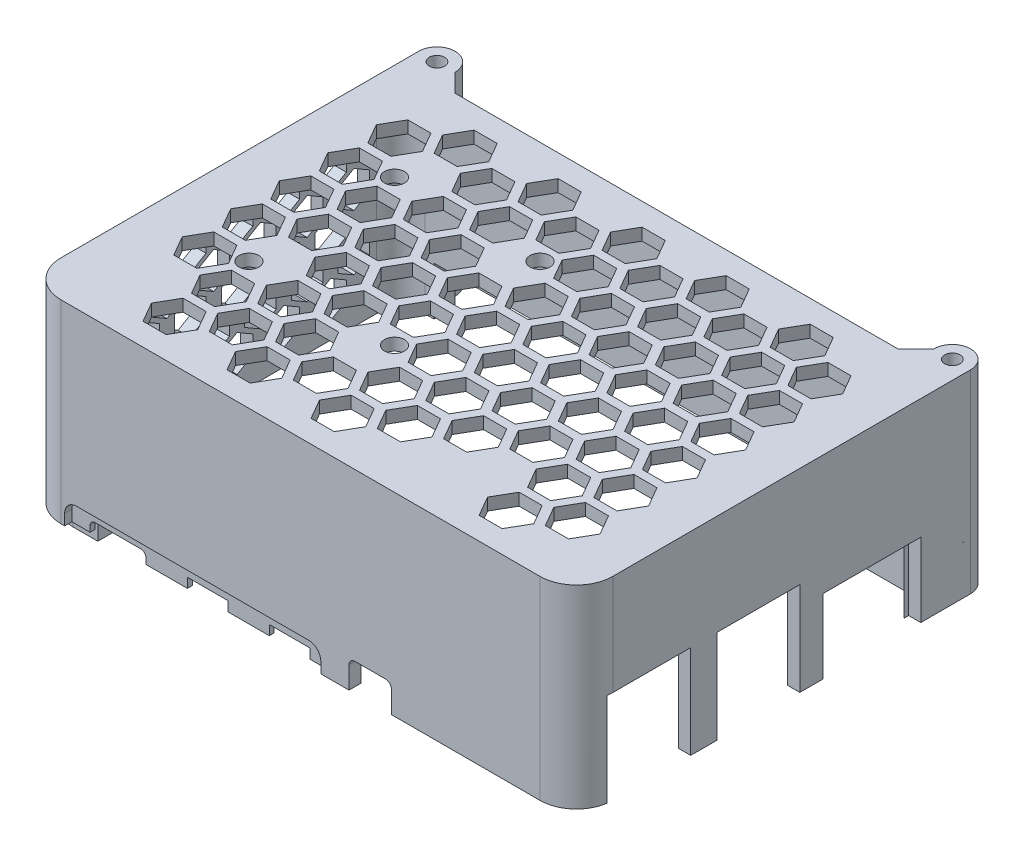
from build123d import *

# Parameters (mm, degrees)
BOSS_EXTRUDE1_DEPTH = 2
BOSS_EXTRUDE2_START = -30
BOSS_EXTRUDE2_DEPTH = 30
BOSS_EXTRUDE3_START = 32
SKETCH12_R          = 1.275
BOSS_EXTRUDE3_DEPTH = 32
BOSS_EXTRUDE4_START = -31.45
SKETCH3_R           = 1.275
BOSS_EXTRUDE4_DEPTH = 31.45
SKETCH5_W           = 2
SKETCH5_H           = 16.1
SKETCH5_H_2         = 13.7
SKETCH5_W_2         = 9.2
SKETCH5_H_3         = 2
SKETCH5_W_3         = 6.7
SKETCH5_W_4         = 7
CUT_EXTRUDE2_DEPTH  = 1.6
CUT_EXTRUDE3_DEPTH  = 0.2
FILLET1_R           = 0.8
SKETCH14_W          = 7
SKETCH14_H          = 2
CUT_EXTRUDE4_DEPTH  = 3
SKETCH15_W          = 2
SKETCH15_H          = 13.7
CUT_EXTRUDE5_DEPTH  = 13.8
CUT_EXTRUDE6_DEPTH  = 10.6
CHAMFER1_SIZE       = 3
CUT_EXTRUDE7_REACH  = 113.055
SKETCH18_W          = 55.5
SKETCH18_H          = 8
FILLET2_R           = 1
CUT_EXTRUDE8_DEPTH  = 1.2
SKETCH23_R          = 1.65
CUT_EXTRUDE11_DEPTH = 115.402371042
FILL_PATTERN1_DEPTH = 2
FILL_START          = -3
FILL_PATTERN5_DEPTH = 2


# Read off the part's stored shape, not the designer's step: Fill Pattern1, Fill Pattern5
# Some blends are built 0.0001 mm under size
with BuildPart() as part:
    # Sketch1 → Boss-Extrude1 (new body)
    with BuildSketch(Plane(origin=(0, 0, 0), x_dir=(1, 0, 0), z_dir=(0, 1, 0))):
        with BuildLine():
            Line((-3, 3), (-3, 53))
            ThreePointArc((-3, 53), (-1.242640687, 57.242640687), (3, 59))
            Line((3, 59), (82, 59))
            ThreePointArc((82, 59), (86.242640687, 57.242640687), (88, 53))
            Line((88, 53), (88, 3))
            ThreePointArc((88, 3), (86.242640687, -1.242640687), (82, -3))
            Line((82, -3), (3, -3))
            ThreePointArc((3, -3), (-1.242640687, -1.242640687), (-3, 3))
        make_face()
    extrude(amount=BOSS_EXTRUDE1_DEPTH)

    # Sketch2 → Boss-Extrude2 (add)
    with BuildSketch(Plane(origin=(0, 0, 0), x_dir=(1, 0, 0), z_dir=(0, 1, 0)).offset(BOSS_EXTRUDE2_START)):
        with BuildLine():
            Line((3, -3), (82, -3))
            ThreePointArc((82, -3), (86.242640687, -1.242640687), (88, 3))
            Line((88, 3), (88, 53))
            ThreePointArc((88, 53), (86.242640687, 57.242640687), (82, 59))
            Line((82, 59), (3, 59))
            ThreePointArc((3, 59), (-1.242640687, 57.242640687), (-3, 53))
            Line((-3, 53), (-3, 3))
            ThreePointArc((-3, 3), (-1.242640687, -1.242640687), (3, -3))
        make_face()
        with BuildLine():
            Line((82, 57), (3, 57))
            ThreePointArc((3, 57), (0.171572875, 55.828427125), (-1, 53))
            Line((-1, 53), (-1, 3))
            ThreePointArc((-1, 3), (0.171572875, 0.171572875), (3, -1))
            Line((3, -1), (82, -1))
            ThreePointArc((82, -1), (84.828427125, 0.171572875), (86, 3))
            Line((86, 3), (86, 53))
            ThreePointArc((86, 53), (84.828427125, 55.828427125), (82, 57))
        make_face(mode=Mode.SUBTRACT)
    extrude(amount=BOSS_EXTRUDE2_DEPTH)

    # Sketch12 → Boss-Extrude3 (add)
    # profile 1 of 2: a face of its own
    with BuildSketch(Plane.XZ.offset(-2).offset(BOSS_EXTRUDE3_START)):
        with BuildLine():
            Line((88, -59), (88, -62))
            ThreePointArc((88, -62), (85, -65), (82, -62))
            Line((82, -62), (82, -59))
            ThreePointArc((82, -59), (86.242640687, -57.242640687), (88, -53))
            Line((88, -53), (88, -59))
        make_face()
        with Locations(Location((85, -62, 0), (0, 0, 90))):
            Circle(SKETCH12_R, mode=Mode.SUBTRACT)
    # profile 2 of 2: a face of its own
    with BuildSketch(Plane.XZ.offset(-2).offset(BOSS_EXTRUDE3_START)):
        with BuildLine():
            Line((-3, -59), (-3, -62))
            ThreePointArc((-3, -62), (0, -65), (3, -62))
            Line((3, -62), (3, -59))
            ThreePointArc((3, -59), (-1.242640687, -57.242640687), (-3, -53))
            Line((-3, -53), (-3, -59))
        make_face()
        with Locations(Location((0, -62, 0), (0, 0, 90))):
            Circle(SKETCH12_R, mode=Mode.SUBTRACT)
    extrude(amount=-BOSS_EXTRUDE3_DEPTH)

    # Sketch3 → Boss-Extrude4 (add)
    # profile 1 of 2: a face of its own
    with BuildSketch(Plane(origin=(0, 0, 0), x_dir=(1, 0, 0), z_dir=(0, 1, 0)).offset(BOSS_EXTRUDE4_START)):
        with BuildLine():
            Line((7.075, 3.5), (7.075, -1))
            Line((7.075, -1), (3, -1))
            ThreePointArc((3, -1), (0.171572875, 0.171572875), (-1, 3))
            Line((-1, 3), (-1, 7.075))
            Line((-1, 7.075), (3.5, 7.075))
            ThreePointArc((3.5, 7.075), (6.027906743, 6.027906743), (7.075, 3.5))
        make_face()
        with Locations(Location((3.5, 3.5, 0), (0, 0, 270))):
            Circle(SKETCH3_R, mode=Mode.SUBTRACT)
    # profile 2 of 2: a face of its own
    with BuildSketch(Plane(origin=(0, 0, 0), x_dir=(1, 0, 0), z_dir=(0, 1, 0)).offset(BOSS_EXTRUDE4_START)):
        with BuildLine():
            Line((64.775, 3.5), (64.775, -1))
            Line((64.775, -1), (58.225, -1))
            Line((58.225, -1), (58.225, 3.5))
            ThreePointArc((58.225, 3.5), (61.5, 6.775), (64.775, 3.5))
        make_face()
        with Locations(Location((61.5, 3.5, 0), (0, 0, 270))):
            Circle(SKETCH3_R, mode=Mode.SUBTRACT)
    extrude(amount=BOSS_EXTRUDE4_DEPTH)

    # Sketch5 → Cut-Extrude2 (cut)
    with BuildSketch(Plane(origin=(0, -30, 0), x_dir=(1, 0, 0), z_dir=(0, 1, 0))):
        with Locations((87, 45.75)):
            Rectangle(SKETCH5_W, SKETCH5_H)
        with Locations((87, 27)):
            Rectangle(SKETCH5_W, SKETCH5_H_2)
        with Locations((87, 9)):
            Rectangle(SKETCH5_W, SKETCH5_H_2)
        with Locations((11.2, -2)):
            Rectangle(SKETCH5_W_2, SKETCH5_H_3)
        with Locations((26, -2)):
            Rectangle(SKETCH5_W_3, SKETCH5_H_3)
        with Locations((39.5, -2)):
            Rectangle(SKETCH5_W_3, SKETCH5_H_3)
        with Locations((54, -2)):
            Rectangle(SKETCH5_W_4, SKETCH5_H_3)
    extrude(amount=CUT_EXTRUDE2_DEPTH, mode=Mode.SUBTRACT)

    # Sketch13 → Cut-Extrude3 (cut)
    with BuildSketch(Plane.XZ.offset(28.4)):
        Polygon((6.6, 3), (6.6, 1), (7.075, 1), (15.8, 1), (15.8, 3), align=None)
    extrude(amount=-CUT_EXTRUDE3_DEPTH, mode=Mode.SUBTRACT)

    # Fillet1
    # the kernel refuses this fillet: 0.8 mm, written as the material it adds along each edge
    with BuildSketch(Plane(origin=(15.8, -28.2, 1), x_dir=(0, -1, 0), z_dir=(0, 0, 1))) as fillet1_piece_1:
        with BuildLine():
            CenterArc((FILLET1_R, -FILLET1_R), FILLET1_R, 90, 90)
            Line((0, -FILLET1_R), (0, 0))
            Line((0, 0), (FILLET1_R, 0))
        make_face()
    extrude(amount=2)
    with BuildSketch(Plane(origin=(6.6, -28.2, 3), x_dir=(1, 0, 0), z_dir=(0, 0, -1))) as fillet1_piece_2:
        with BuildLine():
            CenterArc((FILLET1_R, FILLET1_R), FILLET1_R, 180, 90)
            Line((0, FILLET1_R), (0, 0))
            Line((0, 0), (FILLET1_R, 0))
        make_face()
    extrude(amount=2)

    # Sketch14 → Cut-Extrude4 (cut)
    with BuildSketch(Plane.XZ.offset(28.4)):
        with Locations((54, 2)):
            Rectangle(SKETCH14_W, SKETCH14_H)
    extrude(amount=-CUT_EXTRUDE4_DEPTH, mode=Mode.SUBTRACT)

    # Sketch15 → Cut-Extrude5 (cut)
    with BuildSketch(Plane.XZ.offset(28.4)):
        with Locations((87, -27)):
            Rectangle(SKETCH15_W, SKETCH15_H)
        with BuildLine():
            Line((87.93948651, -2.15), (86, -2.15))
            Line((86, -2.15), (86, -3))
            Line((86, -3), (86, -15.85))
            Line((86, -15.85), (88, -15.85))
            Line((88, -15.85), (88, -3))
            ThreePointArc((88, -3), (87.984852507, -2.573924337), (87.93948651, -2.15))
        make_face()
    extrude(amount=-CUT_EXTRUDE5_DEPTH, mode=Mode.SUBTRACT)

    # Sketch16 → Cut-Extrude6 (cut)
    with BuildSketch(Plane.XZ.offset(28.4)):
        Polygon((86, -53), (86, -53.8), (88, -53.8), (88, -37.7), (86, -37.7), align=None)
    extrude(amount=-CUT_EXTRUDE6_DEPTH, mode=Mode.SUBTRACT)

    # Chamfer1
    chamfer1_edges = [part.edges().sort_by_distance(p)[0] for p in [
        (3, -14, -59),
        (82, -14, -59),
    ]]
    chamfer(chamfer1_edges, length=CHAMFER1_SIZE - 0.0001)  # a hair under: the kernel refuses the full size

    # Sketch18 → Cut-Extrude7 (cut, up to next)
    with BuildSketch(Plane.XY.offset(-57), mode=Mode.PRIVATE) as cut_extrude7_sk1:
        with Locations((32.25, -26)):
            Rectangle(SKETCH18_W, SKETCH18_H)
    cut_extrude7_tool1 = extrude(cut_extrude7_sk1.sketch, amount=-CUT_EXTRUDE7_REACH, mode=Mode.PRIVATE) & part.part
    add(cut_extrude7_tool1.solids().sort_by_distance((32.25, -26, -57))[0], mode=Mode.SUBTRACT)

    # Fillet2
    fillet2_edges = [part.edges().sort_by_distance(p)[0] for p in [
        (57.5, -25.4, 2),
        (50.5, -25.4, 2),
    ]]
    fillet(fillet2_edges, radius=FILLET2_R)

    # Sketch19 → Cut-Extrude8 (cut)
    with BuildSketch(Plane.XY.offset(3)):
        with BuildLine():
            Line((5.6, -26.2), (43.85, -26.2))
            ThreePointArc((43.85, -26.2), (45.264213562, -26.785786438), (45.85, -28.2))
            Line((45.85, -28.2), (45.85, -30))
            Line((45.85, -30), (3.6, -30))
            Line((3.6, -30), (3.6, -28.2))
            ThreePointArc((3.6, -28.2), (4.185786438, -26.785786438), (5.6, -26.2))
        make_face()
    extrude(amount=-CUT_EXTRUDE8_DEPTH, mode=Mode.SUBTRACT)

    # Sketch23 → Cut-Extrude11 (cut, through all)
    with BuildSketch(Plane(origin=(0, 2, 0), x_dir=(1, 0, 0), z_dir=(0, 1, 0))):
        with Locations(Location((13, 42, 0), (0, 0, 270))):
            Circle(SKETCH23_R)
        with Locations(Location((37, 42, 0), (0, 0, 270))):
            Circle(SKETCH23_R)
        with Locations(Location((37, 18, 0), (0, 0, 270))):
            Circle(SKETCH23_R)
        with Locations(Location((13, 18, 0), (0, 0, 270))):
            Circle(SKETCH23_R)
    extrude(amount=-CUT_EXTRUDE11_DEPTH, mode=Mode.SUBTRACT)

    # Fill Pattern1 outline → Fill Pattern1 (cut)
    with BuildSketch(Plane(origin=(0, 0, 0), x_dir=(1, 0, 0), z_dir=(0, 1, 0))):
        Polygon((12.831931191, 7.3), (10.926675302, 4), (12.831931191, 0.7), (16.642442967, 0.7), (18.547698856, 4), (16.642442967, 7.3), align=None)
        Polygon((26.688337651, 31.3), (24.783081763, 28), (26.688337651, 24.7), (30.498849428, 24.7), (32.404105316, 28), (30.498849428, 31.3), align=None)
        Polygon((40.544744112, 55.3), (38.639488223, 52), (40.544744112, 48.7), (44.355255888, 48.7), (46.260511777, 52), (44.355255888, 55.3), align=None)
        Polygon((19.760134421, 19.3), (17.854878533, 16), (19.760134421, 12.7), (23.570646197, 12.7), (25.475902086, 16), (23.570646197, 19.3), align=None)
        Polygon((72.068068809, 7.3), (68.257557033, 7.3), (66.352301144, 4), (68.257557033, 0.7), (72.068068809, 0.7), (73.973324698, 4), align=None)
        Polygon((44.355255888, 7.3), (40.544744112, 7.3), (38.639488223, 4), (40.544744112, 0.7), (44.355255888, 0.7), (46.260511777, 4), align=None)
        Polygon((30.498849428, 7.3), (26.688337651, 7.3), (24.783081763, 4), (26.688337651, 0.7), (30.498849428, 0.7), (32.404105316, 4), align=None)
        Polygon((11.619495625, 16), (9.714239737, 19.3), (5.90372796, 19.3), (3.998472072, 16), (5.90372796, 12.7), (9.714239737, 12.7), align=None)
        Polygon((47.472947342, 27.3), (45.567691454, 24), (47.472947342, 20.7), (51.283459119, 20.7), (53.188715007, 24), (51.283459119, 27.3), align=None)
        Polygon((54.401150572, 39.3), (52.495894684, 36), (54.401150572, 32.7), (58.211662349, 32.7), (60.116918237, 36), (58.211662349, 39.3), align=None)
        Polygon((40.544744112, 15.3), (38.639488223, 12), (40.544744112, 8.7), (44.355255888, 8.7), (46.260511777, 12), (44.355255888, 15.3), align=None)
        Polygon((61.329353803, 51.3), (59.424097914, 48), (61.329353803, 44.7), (65.139865579, 44.7), (67.045121467, 48), (65.139865579, 51.3), align=None)
        Polygon((37.427052658, 27.3), (33.616540881, 27.3), (31.711284993, 24), (33.616540881, 20.7), (37.427052658, 20.7), (39.332308546, 24), align=None)
        Polygon((23.570646197, 27.3), (19.760134421, 27.3), (17.854878533, 24), (19.760134421, 20.7), (23.570646197, 20.7), (25.475902086, 24), align=None)
        Polygon((9.714239737, 27.3), (5.90372796, 27.3), (3.998472072, 24), (5.90372796, 20.7), (9.714239737, 20.7), (11.619495625, 24), align=None)
        Polygon((78.99627204, 27.3), (75.185760263, 27.3), (73.280504375, 24), (75.185760263, 20.7), (78.99627204, 20.7), (80.901527928, 24), align=None)
        Polygon((65.139865579, 27.3), (61.329353803, 27.3), (59.424097914, 24), (61.329353803, 20.7), (65.139865579, 20.7), (67.045121467, 24), align=None)
        Polygon((46.260511777, 36), (44.355255888, 39.3), (40.544744112, 39.3), (38.639488223, 36), (40.544744112, 32.7), (44.355255888, 32.7), align=None)
        Polygon((39.332308546, 48), (37.427052658, 51.3), (33.616540881, 51.3), (31.711284993, 48), (33.616540881, 44.7), (37.427052658, 44.7), align=None)
        Polygon((60.116918237, 12), (58.211662349, 15.3), (54.401150572, 15.3), (52.495894684, 12), (54.401150572, 8.7), (58.211662349, 8.7), align=None)
        Polygon((47.472947342, 35.3), (45.567691454, 32), (47.472947342, 28.7), (51.283459119, 28.7), (53.188715007, 32), (51.283459119, 35.3), align=None)
        Polygon((54.401150572, 47.3), (52.495894684, 44), (54.401150572, 40.7), (58.211662349, 40.7), (60.116918237, 44), (58.211662349, 47.3), align=None)
        Polygon((33.616540881, 11.3), (31.711284993, 8), (33.616540881, 4.7), (37.427052658, 4.7), (39.332308546, 8), (37.427052658, 11.3), align=None)
        Polygon((40.544744112, 23.3), (38.639488223, 20), (40.544744112, 16.7), (44.355255888, 16.7), (46.260511777, 20), (44.355255888, 23.3), align=None)
        Polygon((9.714239737, 35.3), (5.90372796, 35.3), (3.998472072, 32), (5.90372796, 28.7), (9.714239737, 28.7), (11.619495625, 32), align=None)
        Polygon((23.570646197, 35.3), (19.760134421, 35.3), (17.854878533, 32), (19.760134421, 28.7), (23.570646197, 28.7), (25.475902086, 32), align=None)
        Polygon((37.427052658, 35.3), (33.616540881, 35.3), (31.711284993, 32), (33.616540881, 28.7), (37.427052658, 28.7), (39.332308546, 32), align=None)
        Polygon((78.99627204, 35.3), (75.185760263, 35.3), (73.280504375, 32), (75.185760263, 28.7), (78.99627204, 28.7), (80.901527928, 32), align=None)
        Polygon((65.139865579, 35.3), (61.329353803, 35.3), (59.424097914, 32), (61.329353803, 28.7), (65.139865579, 28.7), (67.045121467, 32), align=None)
        Polygon((60.116918237, 20), (58.211662349, 23.3), (54.401150572, 23.3), (52.495894684, 20), (54.401150572, 16.7), (58.211662349, 16.7), align=None)
        Polygon((46.260511777, 44), (44.355255888, 47.3), (40.544744112, 47.3), (38.639488223, 44), (40.544744112, 40.7), (44.355255888, 40.7), align=None)
        Polygon((47.472947342, 43.3), (45.567691454, 40), (47.472947342, 36.7), (51.283459119, 36.7), (53.188715007, 40), (51.283459119, 43.3), align=None)
        Polygon((40.544744112, 31.3), (38.639488223, 28), (40.544744112, 24.7), (44.355255888, 24.7), (46.260511777, 28), (44.355255888, 31.3), align=None)
        Polygon((54.401150572, 55.3), (52.495894684, 52), (54.401150572, 48.7), (58.211662349, 48.7), (60.116918237, 52), (58.211662349, 55.3), align=None)
        Polygon((23.570646197, 43.3), (19.760134421, 43.3), (17.854878533, 40), (19.760134421, 36.7), (23.570646197, 36.7), (25.475902086, 40), align=None)
        Polygon((9.714239737, 43.3), (5.90372796, 43.3), (3.998472072, 40), (5.90372796, 36.7), (9.714239737, 36.7), (11.619495625, 40), align=None)
        Polygon((78.99627204, 43.3), (75.185760263, 43.3), (73.280504375, 40), (75.185760263, 36.7), (78.99627204, 36.7), (80.901527928, 40), align=None)
        Polygon((65.139865579, 43.3), (61.329353803, 43.3), (59.424097914, 40), (61.329353803, 36.7), (65.139865579, 36.7), (67.045121467, 40), align=None)
        Polygon((60.116918237, 28), (58.211662349, 31.3), (54.401150572, 31.3), (52.495894684, 28), (54.401150572, 24.7), (58.211662349, 24.7), align=None)
        Polygon((67.045121467, 16), (65.139865579, 19.3), (61.329353803, 19.3), (59.424097914, 16), (61.329353803, 12.7), (65.139865579, 12.7), align=None)
        Polygon((47.472947342, 51.3), (45.567691454, 48), (47.472947342, 44.7), (51.283459119, 44.7), (53.188715007, 48), (51.283459119, 51.3), align=None)
        Polygon((26.688337651, 15.3), (24.783081763, 12), (26.688337651, 8.7), (30.498849428, 8.7), (32.404105316, 12), (30.498849428, 15.3), align=None)
        Polygon((9.714239737, 51.3), (5.90372796, 51.3), (3.998472072, 48), (5.90372796, 44.7), (9.714239737, 44.7), (11.619495625, 48), align=None)
        Polygon((23.570646197, 51.3), (19.760134421, 51.3), (17.854878533, 48), (19.760134421, 44.7), (23.570646197, 44.7), (25.475902086, 48), align=None)
        Polygon((78.99627204, 51.3), (75.185760263, 51.3), (73.280504375, 48), (75.185760263, 44.7), (78.99627204, 44.7), (80.901527928, 48), align=None)
        Polygon((73.973324698, 12), (72.068068809, 15.3), (68.257557033, 15.3), (66.352301144, 12), (68.257557033, 8.7), (72.068068809, 8.7), align=None)
        Polygon((12.831931191, 31.3), (10.926675302, 28), (12.831931191, 24.7), (16.642442967, 24.7), (18.547698856, 28), (16.642442967, 31.3), align=None)
        Polygon((26.688337651, 55.3), (24.783081763, 52), (26.688337651, 48.7), (30.498849428, 48.7), (32.404105316, 52), (30.498849428, 55.3), align=None)
        Polygon((72.068068809, 31.3), (68.257557033, 31.3), (66.352301144, 28), (68.257557033, 24.7), (72.068068809, 24.7), (73.973324698, 28), align=None)
        Polygon((18.547698856, 52), (16.642442967, 55.3), (12.831931191, 55.3), (10.926675302, 52), (12.831931191, 48.7), (16.642442967, 48.7), align=None)
        Polygon((53.188715007, 16), (51.283459119, 19.3), (47.472947342, 19.3), (45.567691454, 16), (47.472947342, 12.7), (51.283459119, 12.7), align=None)
        Polygon((30.498849428, 39.3), (26.688337651, 39.3), (24.783081763, 36), (26.688337651, 32.7), (30.498849428, 32.7), (32.404105316, 36), align=None)
        Polygon((16.642442967, 39.3), (12.831931191, 39.3), (10.926675302, 36), (12.831931191, 32.7), (16.642442967, 32.7), (18.547698856, 36), align=None)
        Polygon((72.068068809, 39.3), (68.257557033, 39.3), (66.352301144, 36), (68.257557033, 32.7), (72.068068809, 32.7), (73.973324698, 36), align=None)
        Polygon((47.472947342, 11.3), (45.567691454, 8), (47.472947342, 4.7), (51.283459119, 4.7), (53.188715007, 8), (51.283459119, 11.3), align=None)
        Polygon((68.257557033, 47.3), (66.352301144, 44), (68.257557033, 40.7), (72.068068809, 40.7), (73.973324698, 44), (72.068068809, 47.3), align=None)
        Polygon((72.068068809, 23.3), (68.257557033, 23.3), (66.352301144, 20), (68.257557033, 16.7), (72.068068809, 16.7), (73.973324698, 20), align=None)
        Polygon((30.498849428, 23.3), (26.688337651, 23.3), (24.783081763, 20), (26.688337651, 16.7), (30.498849428, 16.7), (32.404105316, 20), align=None)
        Polygon((68.257557033, 55.3), (66.352301144, 52), (68.257557033, 48.7), (72.068068809, 48.7), (73.973324698, 52), (72.068068809, 55.3), align=None)
        Polygon((30.498849428, 47.3), (26.688337651, 47.3), (24.783081763, 44), (26.688337651, 40.7), (30.498849428, 40.7), (32.404105316, 44), align=None)
        Polygon((80.901527928, 8), (78.99627204, 11.3), (75.185760263, 11.3), (73.280504375, 8), (75.185760263, 4.7), (78.99627204, 4.7), align=None)
        Polygon((12.831931191, 15.3), (10.926675302, 12), (12.831931191, 8.7), (16.642442967, 8.7), (18.547698856, 12), (16.642442967, 15.3), align=None)
        Polygon((80.901527928, 16), (78.99627204, 19.3), (75.185760263, 19.3), (73.280504375, 16), (75.185760263, 12.7), (78.99627204, 12.7), align=None)
        Polygon((19.760134421, 11.3), (17.854878533, 8), (19.760134421, 4.7), (23.570646197, 4.7), (25.475902086, 8), (23.570646197, 11.3), align=None)
    extrude(amount=FILL_PATTERN1_DEPTH, mode=Mode.SUBTRACT)

    # Fill Pattern5 outline → Fill Pattern5 (cut)
    with BuildSketch(Plane.YZ.offset(FILL_START)):
        Polygon((-21.096266659, -46.723052079), (-22.596266659, -49.321128291), (-21.096266659, -51.919204502), (-18.096266659, -51.919204502), (-16.596266659, -49.321128291), (-18.096266659, -46.723052079), align=None)
        Polygon((-11.903733341, -51.919204502), (-8.903733341, -51.919204502), (-7.403733341, -49.321128291), (-8.903733341, -46.723052079), (-11.903733341, -46.723052079), (-13.403733341, -49.321128291), align=None)
        Polygon((-21.096266659, -23.582698131), (-22.596266659, -26.180774342), (-21.096266659, -28.778850553), (-18.096266659, -28.778850553), (-16.596266659, -26.180774342), (-18.096266659, -23.582698131), align=None)
        Polygon((-11.903733341, -28.778850553), (-8.903733341, -28.778850553), (-7.403733341, -26.180774342), (-8.903733341, -23.582698131), (-11.903733341, -23.582698131), (-13.403733341, -26.180774342), align=None)
        Polygon((-21.096266659, -15.869246814), (-22.596266659, -18.467323026), (-21.096266659, -21.065399237), (-18.096266659, -21.065399237), (-16.596266659, -18.467323026), (-18.096266659, -15.869246814), align=None)
        Polygon((-11.903733341, -21.065399237), (-8.903733341, -21.065399237), (-7.403733341, -18.467323026), (-8.903733341, -15.869246814), (-11.903733341, -15.869246814), (-13.403733341, -18.467323026), align=None)
        Polygon((-21.096266659, -8.155795498), (-22.596266659, -10.753871709), (-21.096266659, -13.351947921), (-18.096266659, -13.351947921), (-16.596266659, -10.753871709), (-18.096266659, -8.155795498), align=None)
        Polygon((-11.903733341, -13.351947921), (-8.903733341, -13.351947921), (-7.403733341, -10.753871709), (-8.903733341, -8.155795498), (-11.903733341, -8.155795498), (-13.403733341, -10.753871709), align=None)
        Polygon((-25.692533317, -27.439423789), (-27.192533317, -30.0375), (-25.692533317, -32.635576211), (-22.692533317, -32.635576211), (-21.192533317, -30.0375), (-22.692533317, -27.439423789), align=None)
        Polygon((-7.307466683, -32.635576211), (-4.307466683, -32.635576211), (-2.807466683, -30.0375), (-4.307466683, -27.439423789), (-7.307466683, -27.439423789), (-8.807466683, -30.0375), align=None)
        Polygon((-16.5, -32.635576211), (-13.5, -32.635576211), (-12, -30.0375), (-13.5, -27.439423789), (-16.5, -27.439423789), (-18, -30.0375), align=None)
        Polygon((-25.692533317, -35.152875105), (-27.192533317, -37.750951316), (-25.692533317, -40.349027528), (-22.692533317, -40.349027528), (-21.192533317, -37.750951316), (-22.692533317, -35.152875105), align=None)
        Polygon((-7.307466683, -40.349027528), (-4.307466683, -40.349027528), (-2.807466683, -37.750951316), (-4.307466683, -35.152875105), (-7.307466683, -35.152875105), (-8.807466683, -37.750951316), align=None)
        Polygon((-16.5, -40.349027528), (-13.5, -40.349027528), (-12, -37.750951316), (-13.5, -35.152875105), (-16.5, -35.152875105), (-18, -37.750951316), align=None)
        Polygon((-21.096266659, -31.296149447), (-22.596266659, -33.894225658), (-21.096266659, -36.492301869), (-18.096266659, -36.492301869), (-16.596266659, -33.894225658), (-18.096266659, -31.296149447), align=None)
        Polygon((-11.903733341, -36.492301869), (-8.903733341, -36.492301869), (-7.403733341, -33.894225658), (-8.903733341, -31.296149447), (-11.903733341, -31.296149447), (-13.403733341, -33.894225658), align=None)
        Polygon((-16.5, -12.012521156), (-18, -14.610597368), (-16.5, -17.208673579), (-13.5, -17.208673579), (-12, -14.610597368), (-13.5, -12.012521156), align=None)
        Polygon((-25.692533317, -17.208673579), (-22.692533317, -17.208673579), (-21.192533317, -14.610597368), (-22.692533317, -12.012521156), (-25.692533317, -12.012521156), (-27.192533317, -14.610597368), align=None)
        Polygon((-7.307466683, -17.208673579), (-4.307466683, -17.208673579), (-2.807466683, -14.610597368), (-4.307466683, -12.012521156), (-7.307466683, -12.012521156), (-8.807466683, -14.610597368), align=None)
        Polygon((-16.5, -19.725972472), (-18, -22.324048684), (-16.5, -24.922124895), (-13.5, -24.922124895), (-12, -22.324048684), (-13.5, -19.725972472), align=None)
        Polygon((-25.692533317, -24.922124895), (-22.692533317, -24.922124895), (-21.192533317, -22.324048684), (-22.692533317, -19.725972472), (-25.692533317, -19.725972472), (-27.192533317, -22.324048684), align=None)
        Polygon((-7.307466683, -24.922124895), (-4.307466683, -24.922124895), (-2.807466683, -22.324048684), (-4.307466683, -19.725972472), (-7.307466683, -19.725972472), (-8.807466683, -22.324048684), align=None)
        Polygon((-16.5, -42.866326421), (-18, -45.464402632), (-16.5, -48.062478844), (-13.5, -48.062478844), (-12, -45.464402632), (-13.5, -42.866326421), align=None)
        Polygon((-25.692533317, -48.062478844), (-22.692533317, -48.062478844), (-21.192533317, -45.464402632), (-22.692533317, -42.866326421), (-25.692533317, -42.866326421), (-27.192533317, -45.464402632), align=None)
        Polygon((-7.307466683, -48.062478844), (-4.307466683, -48.062478844), (-2.807466683, -45.464402632), (-4.307466683, -42.866326421), (-7.307466683, -42.866326421), (-8.807466683, -45.464402632), align=None)
        Polygon((-21.096266659, -39.009600763), (-22.596266659, -41.607676974), (-21.096266659, -44.205753186), (-18.096266659, -44.205753186), (-16.596266659, -41.607676974), (-18.096266659, -39.009600763), align=None)
        Polygon((-11.903733341, -44.205753186), (-8.903733341, -44.205753186), (-7.403733341, -41.607676974), (-8.903733341, -39.009600763), (-11.903733341, -39.009600763), (-13.403733341, -41.607676974), align=None)
    extrude(amount=FILL_PATTERN5_DEPTH, mode=Mode.SUBTRACT)


solid = part.part
